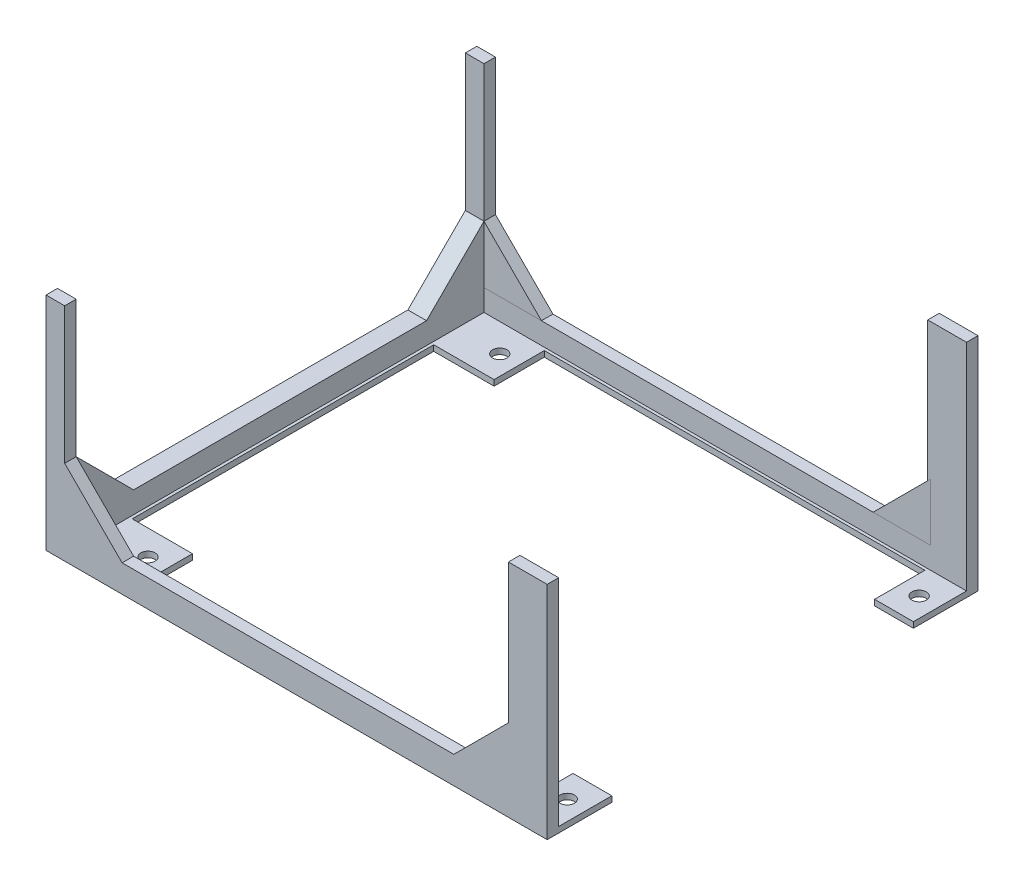
from build123d import *

# Parameters (mm, degrees)
SKETCH1_R            = 0.9999999999999983
SKETCH1_R_2          = 1.0000000000000002
SKETCH1_R_3          = 1.0000000000000013
BOSS_EXTRUDE1_DEPTH  = 0.8
BOSS_EXTRUDE2_DEPTH  = 3
SKETCH3_W            = 2.6000000000000014
SKETCH3_H            = 1.6000000000000156
SKETCH3_W_2          = 5.400000000000002
SKETCH3_H_2          = 1.6066889909461715
SKETCH3_H_3          = 1.6000000000000094
BOSS_EXTRUDE3_DEPTH  = 27
LOFT4_START          = 7.4
LOFT4_DEPTH          = 1.6
LOFT4_START_2        = 7.403174683
LOFT4_2_DEPTH        = 0.596825317
MIRROR6_START        = 7.4
MIRROR6_COPY_1_DEPTH = 1.6
MIRROR6_START_2      = 7.403174683
MIRROR6_COPY_2_DEPTH = 0.596825317
MIRROR6_COPY_3_DEPTH = 1.6
MIRROR6_COPY_4_DEPTH = 0.596825317


with BuildPart() as part:
    # Sketch1 → Boss-Extrude1 (new body)
    with BuildSketch(Plane(origin=(0, 0, 0), x_dir=(1, 0, 0), z_dir=(0, 1, 0))):
        Polygon((0, 0), (5.4, 0), (5.400000000000007, -7.000000000000003), (5.400000000000002, -8.999999999999995), (-58.4, -8.999999999999995), (-61.40000000000001, -8.999999999999995), (-64.4, -8.999999999999995), (-64.4, 51), (-61.40000000000001, 51), (-58.4, 51), (5.400000000000004, 50.99999999999999), (5.400000000000004, 48.99999999999999), (5.4, 42.00000000000001), (0, 41.99999999999999), (-6.07e-15, 48.99999999999999), (-53.00000000000001, 48.99999999999999), (-53.00000000000001, 41.99999999999999), (-58.400000000000006, 41.99999999999999), (-61.40000000000001, 41.99999999999999), (-61.40000000000001, 0), (-58.400000000000006, 0), (-53.00000000000001, -1.73e-15), (-53.00000000000001, -6.999999999999986), (-6.14e-15, -6.999999999999999), align=None)
        with Locations(Location((-55.70000000000001, -3.4999999999999885, 0), (0, 0, 270))):
            Circle(SKETCH1_R, mode=Mode.SUBTRACT)
        with Locations(Location((2.700000000000006, -3.499999999999999, 0), (0, 0, 270))):
            Circle(SKETCH1_R_2, mode=Mode.SUBTRACT)
        with Locations(Location((2.7000000000000015, 45.5, 0), (0, 0, 90))):
            Circle(SKETCH1_R_3, mode=Mode.SUBTRACT)
        with Locations(Location((-55.7, 45.5, 0), (0, 0, 90))):
            Circle(SKETCH1_R, mode=Mode.SUBTRACT)
    extrude(amount=BOSS_EXTRUDE1_DEPTH)

    # Sketch2 → Boss-Extrude2 (add)
    with BuildSketch(Plane(origin=(0, 0.8, 0), x_dir=(1, 0, 0), z_dir=(0, 1, 0))):
        Polygon((-64.4, 51), (5.400000000000002, 51), (5.400000000000002, 49.39999999999999), (-61.800000000000004, 49.39999999999999), (-61.800000000000004, -7.399999999999985), (5.400000000000009, -7.399999999999985), (5.400000000000002, -8.999999999999995), (-64.4, -8.999999999999995), align=None)
    extrude(amount=BOSS_EXTRUDE2_DEPTH)

    # Sketch3 → Boss-Extrude3 (add)
    with BuildSketch(Plane(origin=(0, 3.8, 0), x_dir=(1, 0, 0), z_dir=(0, 1, 0))):
        with Locations((-63.10000000000001, 50.2)):
            Rectangle(SKETCH3_W, SKETCH3_H)
        with Locations((2.700000000000001, 50.2)):
            Rectangle(SKETCH3_W_2, SKETCH3_H)
        with Locations((2.700000000000001, -8.196655504526909)):
            Rectangle(SKETCH3_W_2, SKETCH3_H_2)
        with Locations((-63.10000000000001, -8.19999999999999)):
            Rectangle(SKETCH3_W, SKETCH3_H_3)
    extrude(amount=BOSS_EXTRUDE3_DEPTH)

    # Sketch9 → Loft3 section 0
    with BuildSketch(Plane(origin=(0, 3.8, 0), x_dir=(1, 0, 0), z_dir=(0, 1, 0))):
        with BuildLine():
            Line((-64.4, -7.399999999999985), (-64.4, 0.6000000000000146))
            Line((-64.4, 0.6000000000000146), (-61.800000000000004, 0.6000000000000149))
            Line((-61.800000000000004, 0.6000000000000149), (-61.800000000000004, -7.399999999999985))
            Line((-61.800000000000004, -7.399999999999985), (-64.4, -7.399999999999985))
        make_face()
    # Sketch7 → Loft3 section 1
    with BuildSketch(Plane(origin=(0, 0, 7.399999999999985), x_dir=(-1, 0, -3.903e-14), z_dir=(3.903e-14, 0, -1))):
        with BuildLine():
            Line((64.40000000000235, 3.8), (64.4000000000023, 11.799999999999999))
            Line((64.4000000000023, 11.799999999999999), (61.80000000000229, 11.799999999999997))
            Line((61.80000000000229, 11.799999999999997), (61.80000000000229, 3.8))
            Line((61.80000000000229, 3.8), (64.40000000000235, 3.8))
        make_face()
    loft3 = loft()

    # Loft4: read off the stored shape, not the designer's step
    # Loft4 outline → Loft4 (add)
    with BuildSketch(Plane.XY.offset(LOFT4_START)):
        Polygon((-61.8, 11.8), (-61.8, 3.8), (-53.8, 3.8), align=None)
    loft4 = extrude(amount=LOFT4_DEPTH)

    # Loft4 2 outline → Loft4 2 (add)
    with BuildSketch(Plane(origin=(0, 0, 0), x_dir=(1, 0, 0), z_dir=(0, 0.0008361235760020348, 0.9999996504486218)).offset(LOFT4_START_2)):
        Polygon((-61.8, 11.793814154), (-61.8, 3.793811357), (-53.8, 3.793811357), align=None)
    loft4_2 = extrude(amount=LOFT4_2_DEPTH)

    # Mirror4: Loft3, Loft4, Loft4 2 across plane
    add(loft3.mirror(Plane.XY.offset(-20.999999999999993)))
    add(loft4.mirror(Plane.XY.offset(-20.999999999999993)))
    add(loft4_2.mirror(Plane.XY.offset(-20.999999999999993)))

    # Mirror5: Loft4, Loft4 2 across plane
    add(loft4.mirror(Plane(origin=(-30.700000000000014, 0, 0), x_dir=(0, 0, 1), z_dir=(1, 0, 0))))
    add(loft4_2.mirror(Plane(origin=(-30.700000000000014, 0, 0), x_dir=(0, 0, 1), z_dir=(1, 0, 0))))

    # Mirror6 copy 1 sketch → Mirror6 copy 1 (add)
    with BuildSketch(Plane(origin=(-61.40000000000003, 0, -41.999999999999986), x_dir=(-1, 0, 0), z_dir=(0, 0, -1)).offset(MIRROR6_START)):
        Polygon((-61.8, 11.8), (-61.8, 3.8), (-53.8, 3.8), align=None)
    extrude(amount=MIRROR6_COPY_1_DEPTH)

    # Mirror6 copy 2 sketch → Mirror6 copy 2 (add)
    with BuildSketch(Plane(origin=(-61.40000000000003, 0, -41.999999999999986), x_dir=(-1, 0, 0), z_dir=(0, 0.0008361235760020348, -0.9999996504486218)).offset(MIRROR6_START_2)):
        Polygon((-61.8, 11.793814154), (-61.8, 3.793811357), (-53.8, 3.793811357), align=None)
    extrude(amount=MIRROR6_COPY_2_DEPTH)

    # Mirror6 copy 3 sketch → Mirror6 copy 3 (add)
    with BuildSketch(Plane(origin=(0, 0, -41.999999999999986), x_dir=(1, 0, 0), z_dir=(0, 0, -1)).offset(MIRROR6_START)):
        Polygon((-61.8, -11.8), (-61.8, -3.8), (-53.8, -3.8), align=None)
    extrude(amount=MIRROR6_COPY_3_DEPTH)

    # Mirror6 copy 4 sketch → Mirror6 copy 4 (add)
    with BuildSketch(Plane(origin=(0, 0, -41.999999999999986), x_dir=(1, 0, 0), z_dir=(0, 0.0008361235760020348, -0.9999996504486218)).offset(MIRROR6_START_2)):
        Polygon((-61.8, -11.793814154), (-61.8, -3.793811357), (-53.8, -3.793811357), align=None)
    extrude(amount=MIRROR6_COPY_4_DEPTH)


solid = part.part
